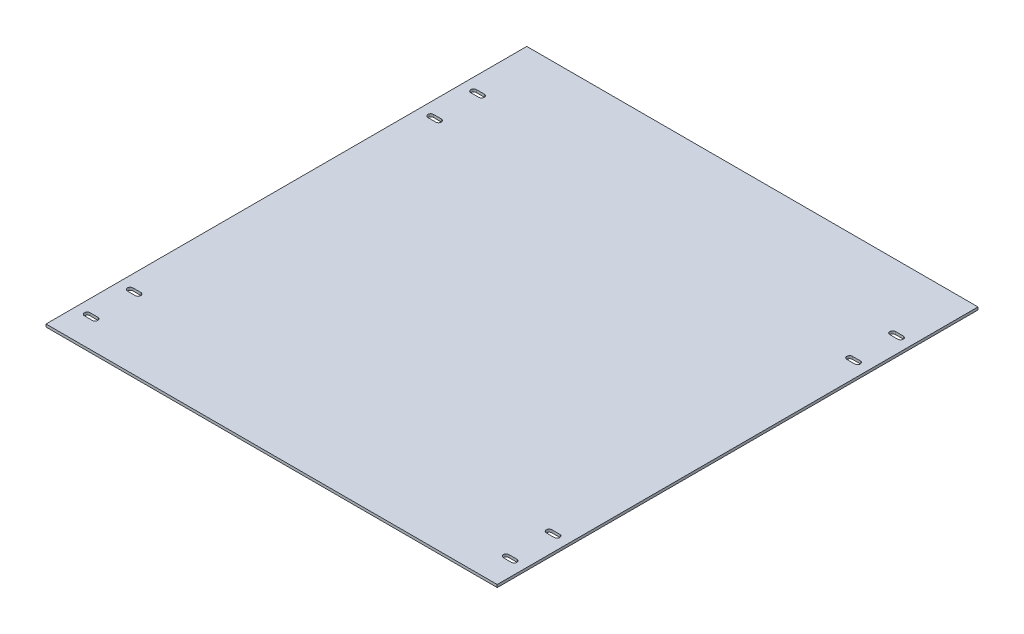
from build123d import *

# Parameters (mm, degrees)
SKETCH1_W                    = 533.4
SKETCH1_H                    = 568.325
BOSS_EXTRUDE1_DEPTH          = 3.175
F_0_257_DIAMETER_SLOT1_DEPTH = 3.175


# Read off the part's stored shape, not the designer's step: F (0.257) Diameter Slot1
with BuildPart() as part:
    # Sketch1 → Boss-Extrude1 (new body)
    with BuildSketch(Plane(origin=(0, 0, 0), x_dir=(1, 0, 0), z_dir=(0, 1, 0))):
        Rectangle(SKETCH1_W, SKETCH1_H)
    extrude(amount=BOSS_EXTRUDE1_DEPTH)

    # F (0.257) Diameter Slot1 outline → F (0.257) Diameter Slot1 (cut)
    with BuildSketch(Plane(origin=(0, 0, 0), x_dir=(1, 0, 0), z_dir=(0, 1, 0))):
        with BuildLine():
            Line((242.9764, 203.6826), (252.3236, 203.6826))
            ThreePointArc((252.3236, 203.6826), (255.5875, 206.9465), (252.3236, 210.2104))
            Line((252.3236, 210.2104), (242.9764, 210.2104))
            ThreePointArc((242.9764, 210.2104), (239.7125, 206.9465), (242.9764, 203.6826))
        make_face()
        with BuildLine():
            ThreePointArc((-242.9764, 203.6826), (-239.7125, 206.9465), (-242.9764, 210.2104))
            Line((-242.9764, 210.2104), (-252.3236, 210.2104))
            ThreePointArc((-252.3236, 210.2104), (-255.5875, 206.9465), (-252.3236, 203.6826))
            Line((-252.3236, 203.6826), (-242.9764, 203.6826))
        make_face()
        with BuildLine():
            Line((242.9764, 152.8826), (252.3236, 152.8826))
            ThreePointArc((252.3236, 152.8826), (255.5875, 156.1465), (252.3236, 159.4104))
            Line((252.3236, 159.4104), (242.9764, 159.4104))
            ThreePointArc((242.9764, 159.4104), (239.7125, 156.1465), (242.9764, 152.8826))
        make_face()
        with BuildLine():
            ThreePointArc((-242.9764, 152.8826), (-239.7125, 156.1465), (-242.9764, 159.4104))
            Line((-242.9764, 159.4104), (-252.3236, 159.4104))
            ThreePointArc((-252.3236, 159.4104), (-255.5875, 156.1465), (-252.3236, 152.8826))
            Line((-252.3236, 152.8826), (-242.9764, 152.8826))
        make_face()
        with BuildLine():
            Line((242.9764, -202.3364), (252.3236, -202.3364))
            ThreePointArc((252.3236, -202.3364), (255.5875, -199.0725), (252.3236, -195.8086))
            Line((252.3236, -195.8086), (242.9764, -195.8086))
            ThreePointArc((242.9764, -195.8086), (239.7125, -199.0725), (242.9764, -202.3364))
        make_face()
        with BuildLine():
            ThreePointArc((-242.9764, -202.3364), (-239.7125, -199.0725), (-242.9764, -195.8086))
            Line((-242.9764, -195.8086), (-252.3236, -195.8086))
            ThreePointArc((-252.3236, -195.8086), (-255.5875, -199.0725), (-252.3236, -202.3364))
            Line((-252.3236, -202.3364), (-242.9764, -202.3364))
        make_face()
        with BuildLine():
            Line((242.9764, -253.1364), (252.3236, -253.1364))
            ThreePointArc((252.3236, -253.1364), (255.5875, -249.8725), (252.3236, -246.6086))
            Line((252.3236, -246.6086), (242.9764, -246.6086))
            ThreePointArc((242.9764, -246.6086), (239.7125, -249.8725), (242.9764, -253.1364))
        make_face()
        with BuildLine():
            ThreePointArc((-242.9764, -253.1364), (-239.7125, -249.8725), (-242.9764, -246.6086))
            Line((-242.9764, -246.6086), (-252.3236, -246.6086))
            ThreePointArc((-252.3236, -246.6086), (-255.5875, -249.8725), (-252.3236, -253.1364))
            Line((-252.3236, -253.1364), (-242.9764, -253.1364))
        make_face()
    extrude(amount=F_0_257_DIAMETER_SLOT1_DEPTH, mode=Mode.SUBTRACT)


solid = part.part
